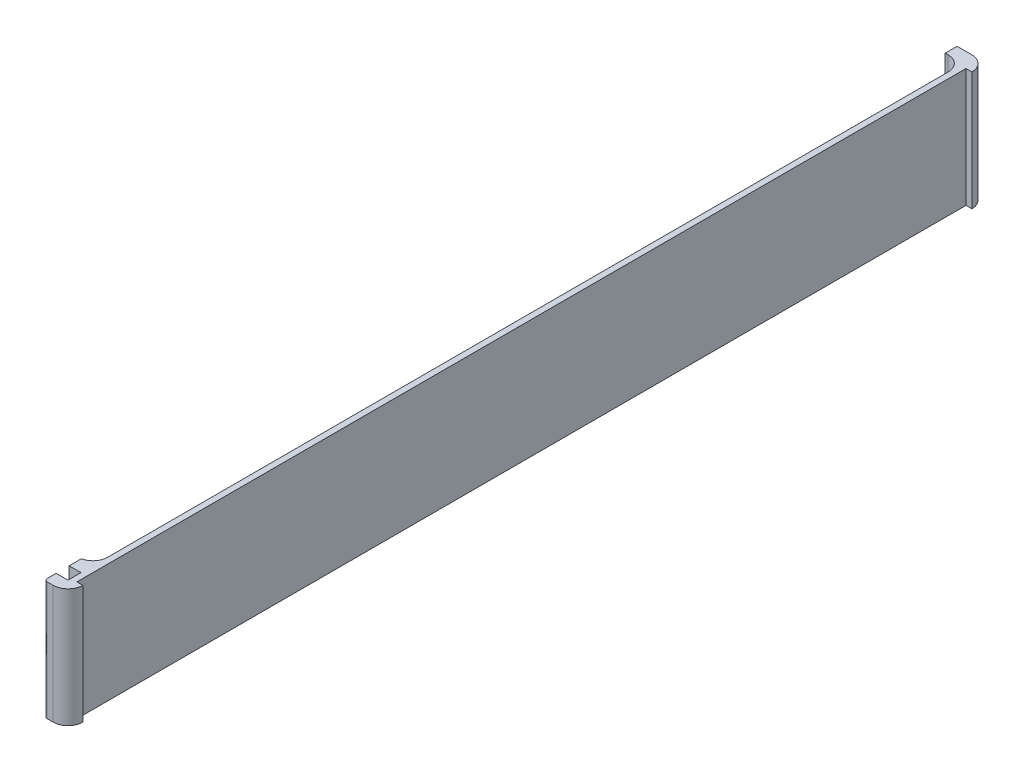
from build123d import *

# Parameters (mm, degrees)
SKETCH1_W                       = 39
SKETCH1_H                       = 155
BOSS_EXTRUDE1_DEPTH             = 2
BOSS_EXTRUDE2_DEPTH             = 38
SKETCH3_W                       = 2
SKETCH3_H                       = 2
BOSS_EXTRUDE3_DEPTH             = 38
SKETCH4_W                       = 2
SKETCH4_H                       = 2
BOSS_EXTRUDE4_DEPTH             = 151
SKETCH6_W                       = 35
SKETCH6_H                       = 2.2
CUT_EXTRUDE1_DEPTH              = 160.340045186
SKETCH7_W                       = 35
SKETCH7_H                       = 2.2
CUT_EXTRUDE2_DEPTH              = 89.490112442
SKETCH5_W                       = 31
SKETCH5_H                       = 2
BOSS_EXTRUDE5_DEPTH             = 2
BOSS_EXTRUDE6_REACH             = 91.367
SKETCH8_W                       = 2
SKETCH8_H                       = 2
BOSS_EXTRUDE6_DIRECTION_2_REACH = 91.367
SKETCH10_W                      = 2
SKETCH10_H                      = 2.2
SKETCH10_W_2                    = 2.2
SKETCH10_H_2                    = 2
BOSS_EXTRUDE8_DEPTH             = 2
SKETCH11_W                      = 2
SKETCH11_H                      = 2.2
SKETCH11_W_2                    = 2.2
SKETCH11_H_2                    = 2
BOSS_EXTRUDE9_DEPTH             = 2
FILLET2_R                       = 2.5
SKETCH14_W                      = 36.5
SKETCH14_H                      = 7.75
BOSS_EXTRUDE10_DEPTH            = 2
SKETCH13_W                      = 31
SKETCH13_H                      = 3
CUT_EXTRUDE4_DEPTH              = 2
FILLET3_R                       = 2
FILLET4_R                       = 0.5
SKETCH15_R                      = 5.1
CUT_EXTRUDE5_DEPTH              = 90.367219941
SKETCH16_R                      = 7.1
BOSS_EXTRUDE11_DEPTH            = 1
FILLET5_R                       = 0.5
CUT_EXTRUDE3_DEPTH              = 160.340045186
FILLET6_R                       = 0.4
FILLET7_R                       = 0.5
CUT_EXTRUDE6_DEPTH              = 6
SKETCH18_W                      = 29
SKETCH18_H                      = 3
CUT_EXTRUDE8_DEPTH              = 90.367220028
CUT_EXTRUDE11_DEPTH             = 90.367220028
CUT_EXTRUDE11_DEPTH_BACK        = 90.367220028
SKETCH20_W                      = 29
SKETCH20_H                      = 34
SKETCH21_W                      = 155
SKETCH21_H                      = 10
CUT_EXTRUDE12_DEPTH             = 90.367219941
SKETCH22_W                      = 150
SKETCH22_H                      = 20
CUT_EXTRUDE13_DEPTH             = 1


with BuildPart() as part:
    # Sketch1 → Boss-Extrude1 (new body)
    with BuildSketch(Plane(origin=(0, 0, 0), x_dir=(1, 0, 0), z_dir=(0, 1, 0))):
        Rectangle(SKETCH1_W, SKETCH1_H)
    extrude(amount=BOSS_EXTRUDE1_DEPTH)

    # Sketch2 → Boss-Extrude2 (add)
    with BuildSketch(Plane(origin=(0, 2, 0), x_dir=(1, 0, 0), z_dir=(0, 1, 0))):
        Polygon((-17.5, -77.5), (-17.5, -75.5), (-17.5, 75.5), (17.5, 75.5), (17.5, -75.5), (17.5, -77.5), (19.5, -77.5), (19.5, 77.5), (-19.5, 77.5), (-19.5, -77.5), align=None)
    extrude(amount=BOSS_EXTRUDE2_DEPTH)

    # Sketch3 → Boss-Extrude3 (add)
    with BuildSketch(Plane(origin=(0, 2, 0), x_dir=(1, 0, 0), z_dir=(0, 1, 0))):
        with Locations((-16.5, -76.5)):
            Rectangle(SKETCH3_W, SKETCH3_H)
        with Locations((-16.5, -72.3)):
            Rectangle(SKETCH3_W, SKETCH3_H)
        with Locations((16.5, -76.5)):
            Rectangle(SKETCH3_W, SKETCH3_H)
        with Locations((16.5, -72.3)):
            Rectangle(SKETCH3_W, SKETCH3_H)
    extrude(amount=BOSS_EXTRUDE3_DEPTH)

    # Sketch4 → Boss-Extrude4 (add)
    with BuildSketch(Plane.XY.offset(-75.5)):
        with Locations((-16.5, 39)):
            Rectangle(SKETCH4_W, SKETCH4_H)
        Polygon((-15.5, 33.8), (-17.5, 31.8), (-17.5, 35.8), (-15.5, 35.8), align=None)
        Polygon((15.5, 35.8), (17.5, 35.8), (17.5, 31.8), (15.5, 33.8), align=None)
        with Locations((16.5, 39)):
            Rectangle(SKETCH4_W, SKETCH4_H)
    extrude(amount=BOSS_EXTRUDE4_DEPTH)

    # Sketch6 → Cut-Extrude1 (cut, through all)
    with BuildSketch(Plane.XY.offset(-75.5)):
        with Locations((0, 36.9)):
            Rectangle(SKETCH6_W, SKETCH6_H)
    extrude(amount=CUT_EXTRUDE1_DEPTH, mode=Mode.SUBTRACT)

    # Sketch7 → Cut-Extrude2 (cut, through all)
    with BuildSketch(Plane(origin=(0, 2, 0), x_dir=(1, 0, 0), z_dir=(0, 1, 0))):
        with Locations((0, -74.4)):
            Rectangle(SKETCH7_W, SKETCH7_H)
    extrude(amount=CUT_EXTRUDE2_DEPTH, mode=Mode.SUBTRACT)

    # Sketch5 → Boss-Extrude5 (add)
    with BuildSketch(Plane(origin=(0, 2, 0), x_dir=(1, 0, 0), z_dir=(0, 1, 0))):
        with Locations((0, -76.5)):
            Rectangle(SKETCH5_W, SKETCH5_H)
        with Locations((0, -72.3)):
            Rectangle(SKETCH5_W, SKETCH5_H)
    extrude(amount=BOSS_EXTRUDE5_DEPTH)

    # Boss-Extrude6: up to this face of the body (flat: up to its plane)
    boss_extrude6_end = Plane(part.part.faces().sort_by_distance((17.5, 16.9, -2.1))[0])
    # Sketch8 → Boss-Extrude6 (add, up to the picked face)
    with BuildSketch(Plane(origin=(0, 0, 0), x_dir=(0, 0, -1), z_dir=(1, 0, 0)), mode=Mode.PRIVATE) as boss_extrude6_sk1:
        with Locations((74.5, 39)):
            Rectangle(SKETCH8_W, SKETCH8_H)
    boss_extrude6_tool1 = split(extrude(boss_extrude6_sk1.sketch, amount=BOSS_EXTRUDE6_REACH, mode=Mode.PRIVATE), bisect_by=boss_extrude6_end, keep=Keep.BOTH, mode=Mode.PRIVATE)
    # Sketch8 → Boss-Extrude6 (add, up to the picked face)
    with BuildSketch(Plane(origin=(0, 0, 0), x_dir=(0, 0, -1), z_dir=(1, 0, 0)), mode=Mode.PRIVATE) as boss_extrude6_sk2:
        Polygon((75.5, 35.8), (73.5, 35.8), (73.5, 33.8), (75.5, 31.8), align=None)
    boss_extrude6_tool2 = split(extrude(boss_extrude6_sk2.sketch, amount=BOSS_EXTRUDE6_REACH, mode=Mode.PRIVATE), bisect_by=boss_extrude6_end, keep=Keep.BOTH, mode=Mode.PRIVATE)
    add(boss_extrude6_tool1.solids().sort_by(Axis((0, 39, -74.5), (1, 0, 0)))[0])
    add(boss_extrude6_tool2.solids().sort_by(Axis((0, 34.244444, -74.611111), (1, 0, 0)))[0])

    # Boss-Extrude6 direction 2: up to this face of the body (flat: up to its plane)
    boss_extrude6_direction_2_end = Plane(part.part.faces().sort_by_distance((-17.5, 16.9, -2.1))[0])
    # Sketch8 → Boss-Extrude6 direction 2 (add, up to the picked face)
    with BuildSketch(Plane(origin=(0, 0, 0), x_dir=(0, 0, -1), z_dir=(1, 0, 0)), mode=Mode.PRIVATE) as boss_extrude6_direction_2_sk1:
        with Locations((74.5, 39)):
            Rectangle(SKETCH8_W, SKETCH8_H)
    boss_extrude6_direction_2_tool1 = split(extrude(boss_extrude6_direction_2_sk1.sketch, amount=-BOSS_EXTRUDE6_DIRECTION_2_REACH, mode=Mode.PRIVATE), bisect_by=boss_extrude6_direction_2_end, keep=Keep.BOTH, mode=Mode.PRIVATE)
    # Sketch8 → Boss-Extrude6 direction 2 (add, up to the picked face)
    with BuildSketch(Plane(origin=(0, 0, 0), x_dir=(0, 0, -1), z_dir=(1, 0, 0)), mode=Mode.PRIVATE) as boss_extrude6_direction_2_sk2:
        Polygon((75.5, 35.8), (73.5, 35.8), (73.5, 33.8), (75.5, 31.8), align=None)
    boss_extrude6_direction_2_tool2 = split(extrude(boss_extrude6_direction_2_sk2.sketch, amount=-BOSS_EXTRUDE6_DIRECTION_2_REACH, mode=Mode.PRIVATE), bisect_by=boss_extrude6_direction_2_end, keep=Keep.BOTH, mode=Mode.PRIVATE)
    add(boss_extrude6_direction_2_tool1.solids().sort_by(Axis((0, 39, -74.5), (-1, 0, 0)))[0])
    add(boss_extrude6_direction_2_tool2.solids().sort_by(Axis((0, 34.244444, -74.611111), (-1, 0, 0)))[0])

    # Sketch10 → Boss-Extrude8 (add)
    with BuildSketch(Plane(origin=(-17.5, 0, 0), x_dir=(0, 0, -1), z_dir=(1, 0, 0))):
        with Locations((-76.5, 36.9)):
            Rectangle(SKETCH10_W, SKETCH10_H)
        with Locations((-74.4, 39)):
            Rectangle(SKETCH10_W_2, SKETCH10_H_2)
    extrude(amount=BOSS_EXTRUDE8_DEPTH)

    # Sketch11 → Boss-Extrude9 (add)
    with BuildSketch(Plane.ZY.offset(-17.5)):
        with Locations((76.5, 36.9)):
            Rectangle(SKETCH11_W, SKETCH11_H)
        with Locations((74.4, 39)):
            Rectangle(SKETCH11_W_2, SKETCH11_H_2)
    extrude(amount=BOSS_EXTRUDE9_DEPTH)

    # Fillet2
    fillet2_edges = [part.edges().sort_by_distance(p)[0] for p in [
        (-17.5, 16.9, 71.3),
        (17.5, 16.9, 71.3),
        (19.5, 20, 77.5),
        (-19.5, 20, 77.5),
        (-19.5, 20, -77.5),
        (-17.5, 16.9, -75.5),
        (17.5, 16.9, -75.5),
        (19.5, 20, -77.5),
        (19.5, 40, 0),
        (-19.5, 40, 0),
        (19.5, 0, 0),
        (-19.5, 0, 0),
        (0, 40, -77.5),
        (0, 0, 77.5),
        (0, 0, -77.5),
        (-17.5, 40, 77.5),
        (17.5, 40, 77.5),
    ]]
    fillet(fillet2_edges, radius=FILLET2_R)

    # Sketch14 → Boss-Extrude10 (add)
    with BuildSketch(Plane.XY.offset(-75.5)):
        with Locations((0, 5.125)):
            Rectangle(SKETCH14_W, SKETCH14_H)
    extrude(amount=BOSS_EXTRUDE10_DEPTH)

    # Sketch13 → Cut-Extrude4 (cut)
    with BuildSketch(Plane(origin=(0, 0, -77.5), x_dir=(-1, 0, 0), z_dir=(0, 0, -1))):
        with Locations((0, 5.5)):
            Rectangle(SKETCH13_W, SKETCH13_H)
    extrude(amount=-CUT_EXTRUDE4_DEPTH, mode=Mode.SUBTRACT)

    # Fillet3
    fillet3_edges = [part.edges().sort_by_distance(p)[0] for p in [
        (0, 9, -73.5),
    ]]
    fillet(fillet3_edges, radius=FILLET3_R - 0.0001)  # a hair under: the kernel refuses the full size

    # Fillet4
    fillet4_edges = [part.edges().sort_by_distance(p)[0] for p in [
        (15.5, 5.5, -75.5),
        (15.5, 4, -76.5),
        (0, 7, -75.5),
        (15.5, 7, -76.5),
        (-15.5, 5.5, -75.5),
        (-15.5, 7, -76.5),
        (0, 4, -75.5),
        (-15.5, 4, -76.5),
        (15.5, 5.5, -77.5),
        (0, 4, -77.5),
        (-15.5, 5.5, -77.5),
        (0, 7, -77.5),
    ]]
    fillet(fillet4_edges, radius=FILLET4_R)

    # Sketch15 → Cut-Extrude5 (cut, through all)
    with BuildSketch(Plane.XZ):
        with Locations(Location((0, 38.75, 0), (0, 0, 270))):
            Circle(SKETCH15_R)
        with Locations(Location((0, -38.75, 0), (0, 0, 270))):
            Circle(SKETCH15_R)
    extrude(amount=-CUT_EXTRUDE5_DEPTH, mode=Mode.SUBTRACT)

    # Sketch16 → Boss-Extrude11 (add)
    with BuildSketch(Plane(origin=(0, 2, 0), x_dir=(1, 0, 0), z_dir=(0, 1, 0))):
        with Locations(Location((0, 38.75, 0), (0, 0, 270))):
            Circle(SKETCH16_R)
        with Locations(Location((0, -38.75, 0), (0, 0, 270))):
            Circle(SKETCH16_R)
    extrude(amount=BOSS_EXTRUDE11_DEPTH)

    # Fillet5
    fillet5_edges = [part.edges().sort_by_distance(p)[0] for p in [
        (0, 2, -45.85),
        (0, 3, -45.85),
        (0, 2, 31.65),
        (0, 3, 31.65),
    ]]
    fillet(fillet5_edges, radius=FILLET5_R - 0.0001)  # a hair under: the kernel refuses the full size

    # Sketch12 → Cut-Extrude3 (cut, through all)
    with BuildSketch(Plane.XY.offset(-75.5)):
        with BuildLine():
            Line((1.668907005, 12.688040659), (2.22520934, 10.250720878))
            ThreePointArc((2.22520934, 10.250720878), (4.338837391, 10.990311321), (6.234898019, 12.181685175))
            Line((6.234898019, 12.181685175), (4.676173514, 14.136263881))
            ThreePointArc((4.676173514, 14.136263881), (3.254128043, 13.242733491), (1.668907005, 12.688040659))
        make_face()
        with BuildLine():
            ThreePointArc((-6.234898019, 12.181685175), (-4.338837391, 10.990311321), (-2.22520934, 10.250720878))
            Line((-2.22520934, 10.250720878), (-1.668907005, 12.688040659))
            ThreePointArc((-1.668907005, 12.688040659), (-3.254128043, 13.242733491), (-4.676173514, 14.136263881))
            Line((-4.676173514, 14.136263881), (-6.234898019, 12.181685175))
        make_face()
        with BuildLine():
            ThreePointArc((-10, 20), (-9.749279122, 17.77479066), (-9.009688679, 15.661162609))
            Line((-9.009688679, 15.661162609), (-6.757266509, 16.745871957))
            ThreePointArc((-6.757266509, 16.745871957), (-7.311959341, 18.331092995), (-7.5, 20))
            Line((-7.5, 20), (-10, 20))
        make_face()
        with BuildLine():
            ThreePointArc((-6.234898019, 27.818314825), (-7.818314825, 26.234898019), (-9.009688679, 24.338837391))
            Line((-9.009688679, 24.338837391), (-6.757266509, 23.254128043))
            ThreePointArc((-6.757266509, 23.254128043), (-5.863736119, 24.676173514), (-4.676173514, 25.863736119))
            Line((-4.676173514, 25.863736119), (-6.234898019, 27.818314825))
        make_face()
        with BuildLine():
            ThreePointArc((-1.668907005, 27.311959341), (-0.839733571, 27.452841574), (0, 27.5))
            Line((0, 27.5), (0, 30))
            ThreePointArc((0, 30), (-1.119644761, 29.937122099), (-2.22520934, 29.749279122))
            Line((-2.22520934, 29.749279122), (-1.668907005, 27.311959341))
        make_face()
        with BuildLine():
            Line((0, 30), (0, 27.5))
            ThreePointArc((0, 27.5), (0.839733571, 27.452841574), (1.668907005, 27.311959341))
            Line((1.668907005, 27.311959341), (2.22520934, 29.749279122))
            ThreePointArc((2.22520934, 29.749279122), (1.119644761, 29.937122099), (0, 30))
        make_face()
        with BuildLine():
            Line((6.757266509, 23.254128043), (9.009688679, 24.338837391))
            ThreePointArc((9.009688679, 24.338837391), (7.818314825, 26.234898019), (6.234898019, 27.818314825))
            Line((6.234898019, 27.818314825), (4.676173514, 25.863736119))
            ThreePointArc((4.676173514, 25.863736119), (5.863736119, 24.676173514), (6.757266509, 23.254128043))
        make_face()
        with BuildLine():
            Line((6.757266509, 16.745871957), (9.009688679, 15.661162609))
            ThreePointArc((9.009688679, 15.661162609), (9.749279122, 17.77479066), (10, 20))
            Line((10, 20), (7.5, 20))
            ThreePointArc((7.5, 20), (7.311959341, 18.331092995), (6.757266509, 16.745871957))
        make_face()
        with BuildLine():
            ThreePointArc((2.5, 20), (2.43731978, 19.443697665), (2.25242217, 18.915290652))
            Line((2.25242217, 18.915290652), (4.50484434, 17.830581304))
            ThreePointArc((4.50484434, 17.830581304), (4.874639561, 18.88739533), (5, 20))
            Line((5, 20), (2.5, 20))
        make_face()
        with BuildLine():
            ThreePointArc((1.558724505, 21.954578706), (1.954578706, 21.558724505), (2.25242217, 21.084709348))
            Line((2.25242217, 21.084709348), (4.50484434, 22.169418696))
            ThreePointArc((4.50484434, 22.169418696), (3.909157412, 23.117449009), (3.117449009, 23.909157412))
            Line((3.117449009, 23.909157412), (1.558724505, 21.954578706))
        make_face()
        with BuildLine():
            Line((0, 25), (0, 22.5))
            ThreePointArc((0, 22.5), (0.27991119, 22.484280525), (0.556302335, 22.43731978))
            Line((0.556302335, 22.43731978), (1.11260467, 24.874639561))
            ThreePointArc((1.11260467, 24.874639561), (0.559822381, 24.968561049), (0, 25))
        make_face()
        with BuildLine():
            ThreePointArc((-0.556302335, 22.43731978), (-0.27991119, 22.484280525), (0, 22.5))
            Line((0, 22.5), (0, 25))
            ThreePointArc((0, 25), (-0.559822381, 24.968561049), (-1.11260467, 24.874639561))
            Line((-1.11260467, 24.874639561), (-0.556302335, 22.43731978))
        make_face()
        with BuildLine():
            ThreePointArc((-2.25242217, 21.084709348), (-1.954578706, 21.558724505), (-1.558724505, 21.954578706))
            Line((-1.558724505, 21.954578706), (-3.117449009, 23.909157412))
            ThreePointArc((-3.117449009, 23.909157412), (-3.909157412, 23.117449009), (-4.50484434, 22.169418696))
            Line((-4.50484434, 22.169418696), (-2.25242217, 21.084709348))
        make_face()
        with BuildLine():
            ThreePointArc((-2.25242217, 18.915290652), (-2.43731978, 19.443697665), (-2.5, 20))
            Line((-2.5, 20), (-5, 20))
            ThreePointArc((-5, 20), (-4.874639561, 18.88739533), (-4.50484434, 17.830581304))
            Line((-4.50484434, 17.830581304), (-2.25242217, 18.915290652))
        make_face()
        with BuildLine():
            ThreePointArc((-3.117449009, 16.090842588), (-2.169418696, 15.49515566), (-1.11260467, 15.125360439))
            Line((-1.11260467, 15.125360439), (-0.556302335, 17.56268022))
            ThreePointArc((-0.556302335, 17.56268022), (-1.084709348, 17.74757783), (-1.558724505, 18.045421294))
            Line((-1.558724505, 18.045421294), (-3.117449009, 16.090842588))
        make_face()
        with BuildLine():
            Line((0.556302335, 17.56268022), (1.11260467, 15.125360439))
            ThreePointArc((1.11260467, 15.125360439), (2.169418696, 15.49515566), (3.117449009, 16.090842588))
            Line((3.117449009, 16.090842588), (1.558724505, 18.045421294))
            ThreePointArc((1.558724505, 18.045421294), (1.084709348, 17.74757783), (0.556302335, 17.56268022))
        make_face()
    extrude(amount=-CUT_EXTRUDE3_DEPTH, mode=Mode.SUBTRACT)

    # Fillet6
    fillet6_edges = [part.edges().sort_by_distance(p)[0] for p in [
        (5.863736119, 24.676173514, -75.5),
        (5.455535766, 26.841025472, -75.5),
        (7.818314825, 26.234898019, -77.5),
        (7.883477594, 23.796482717, -77.5),
        (5.863736119, 24.676173514, -77.5),
        (5.455535766, 26.841025472, -77.5),
        (7.883477594, 23.796482717, -75.5),
        (7.818314825, 26.234898019, -75.5),
        (7.311959341, 18.331092995, -75.5),
        (8.75, 20, -75.5),
        (9.749279122, 17.77479066, -77.5),
        (7.883477594, 16.203517283, -77.5),
        (7.311959341, 18.331092995, -77.5),
        (8.75, 20, -77.5),
        (7.883477594, 16.203517283, -75.5),
        (9.749279122, 17.77479066, -75.5),
        (2.43731978, 19.443697665, -75.5),
        (3.75, 20, -75.5),
        (4.874639561, 18.88739533, -77.5),
        (3.378633255, 18.372935978, -77.5),
        (2.43731978, 19.443697665, -77.5),
        (3.75, 20, -77.5),
        (3.378633255, 18.372935978, -75.5),
        (4.874639561, 18.88739533, -75.5),
        (1.954578706, 21.558724505, -75.5),
        (2.338086757, 22.931868059, -75.5),
        (3.909157412, 23.117449009, -77.5),
        (3.378633255, 21.627064022, -77.5),
        (1.954578706, 21.558724505, -77.5),
        (2.338086757, 22.931868059, -77.5),
        (3.378633255, 21.627064022, -75.5),
        (3.909157412, 23.117449009, -75.5),
        (0, 27.5, -75.5),
        (-1.947058172, 28.530619232, -75.5),
        (0, 30, -77.5),
        (1.947058172, 28.530619232, -77.5),
        (0, 27.5, -77.5),
        (-1.947058172, 28.530619232, -77.5),
        (1.947058172, 28.530619232, -75.5),
        (0, 30, -75.5),
        (-5.863736119, 24.676173514, -75.5),
        (-7.883477594, 23.796482717, -75.5),
        (-7.818314825, 26.234898019, -77.5),
        (-5.455535766, 26.841025472, -77.5),
        (-5.863736119, 24.676173514, -77.5),
        (-7.883477594, 23.796482717, -77.5),
        (-5.455535766, 26.841025472, -75.5),
        (-7.818314825, 26.234898019, -75.5),
        (-7.311959341, 18.331092995, -75.5),
        (-7.883477594, 16.203517283, -75.5),
        (-9.749279122, 17.77479066, -77.5),
        (-8.75, 20, -77.5),
        (-7.311959341, 18.331092995, -77.5),
        (-7.883477594, 16.203517283, -77.5),
        (-8.75, 20, -75.5),
        (-9.749279122, 17.77479066, -75.5),
        (-3.254128043, 13.242733491, -75.5),
        (-1.947058172, 11.469380768, -75.5),
        (-4.338837391, 10.990311321, -77.5),
        (-5.455535766, 13.158974528, -77.5),
        (-3.254128043, 13.242733491, -77.5),
        (-1.947058172, 11.469380768, -77.5),
        (-5.455535766, 13.158974528, -75.5),
        (-4.338837391, 10.990311321, -75.5),
        (1.084709348, 17.74757783, -75.5),
        (2.338086757, 17.068131941, -75.5),
        (2.169418696, 15.49515566, -77.5),
        (0.834453502, 16.344020329, -77.5),
        (1.084709348, 17.74757783, -77.5),
        (2.338086757, 17.068131941, -77.5),
        (0.834453502, 16.344020329, -75.5),
        (2.169418696, 15.49515566, -75.5),
        (-2.43731978, 19.443697665, -75.5),
        (-3.378633255, 18.372935978, -75.5),
        (-4.874639561, 18.88739533, -77.5),
        (-3.75, 20, -77.5),
        (-2.43731978, 19.443697665, -77.5),
        (-3.378633255, 18.372935978, -77.5),
        (-3.75, 20, -75.5),
        (-4.874639561, 18.88739533, -75.5),
        (-1.084709348, 17.74757783, -75.5),
        (-0.834453502, 16.344020329, -75.5),
        (-2.169418696, 15.49515566, -77.5),
        (-2.338086757, 17.068131941, -77.5),
        (-1.084709348, 17.74757783, -77.5),
        (-0.834453502, 16.344020329, -77.5),
        (-2.338086757, 17.068131941, -75.5),
        (-2.169418696, 15.49515566, -75.5),
        (-1.954578706, 21.558724505, -75.5),
        (-3.378633255, 21.627064022, -75.5),
        (-3.909157412, 23.117449009, -77.5),
        (-2.338086757, 22.931868059, -77.5),
        (-1.954578706, 21.558724505, -77.5),
        (-3.378633255, 21.627064022, -77.5),
        (-2.338086757, 22.931868059, -75.5),
        (-3.909157412, 23.117449009, -75.5),
        (0, 25, -77.5),
        (0.834453502, 23.655979671, -77.5),
        (0, 22.5, -75.5),
        (-0.834453502, 23.655979671, -75.5),
        (0, 22.5, -77.5),
        (-0.834453502, 23.655979671, -77.5),
        (0, 25, -75.5),
        (0.834453502, 23.655979671, -75.5),
        (3.254128043, 13.242733491, -75.5),
        (5.455535766, 13.158974528, -75.5),
        (4.338837391, 10.990311321, -77.5),
        (1.947058172, 11.469380768, -77.5),
        (3.254128043, 13.242733491, -77.5),
        (5.455535766, 13.158974528, -77.5),
        (1.947058172, 11.469380768, -75.5),
        (4.338837391, 10.990311321, -75.5),
    ]]
    fillet(fillet6_edges, radius=FILLET6_R)

    # Fillet7
    fillet7_edges = [part.edges().sort_by_distance(p)[0] for p in [
        (15.5, 40, 0.75),
        (0, 4, 77.5),
        (0, 40, -73.5),
        (-15.5, 40, 0.75),
        (-15.5, 20.75, 77.5),
        (-15.5, 39.267766953, 76.767766953),
        (15.5, 20.75, 77.5),
        (15.5, 39.267766953, 76.767766953),
    ]]
    fillet(fillet7_edges, radius=FILLET7_R)

    # Sketch17 → Cut-Extrude6 (cut)
    with BuildSketch(Plane.XZ):
        Polygon((-17, -77.5), (-17, 70.299999999), (-14.999999999, 71.3), (-14.999999999, 77.5), (14.999999999, 77.5), (14.999999999, 71.3), (17, 70.299999999), (17, -77.5), align=None)
    extrude(amount=-CUT_EXTRUDE6_DEPTH, mode=Mode.SUBTRACT)

    # Sketch18 → Cut-Extrude8 (cut, through all)
    with BuildSketch(Plane.XY):
        with Locations((0, 7.5)):
            Rectangle(SKETCH18_W, SKETCH18_H)
    extrude(amount=-CUT_EXTRUDE8_DEPTH, mode=Mode.SUBTRACT)

    # Sketch20 → Cut-Extrude11 (cut, two sides: drawn at the far end of the back side and taken through both)
    with BuildSketch(Plane.XY.offset(-CUT_EXTRUDE11_DEPTH_BACK)):
        with Locations((0, 23)):
            Rectangle(SKETCH20_W, SKETCH20_H)
    extrude(amount=CUT_EXTRUDE11_DEPTH + CUT_EXTRUDE11_DEPTH_BACK, mode=Mode.SUBTRACT)


with BuildPart() as body_2:
    # of the pieces the cut leaves, the one that is kept (cut_extrude11_keep)
    add(part.part.solids().sort_by_distance((14.5, 40, -75))[0])

    # Sketch21 → Cut-Extrude12 (cut, through all)
    with BuildSketch(Plane(origin=(0, 0, 0), x_dir=(0, 0, -1), z_dir=(1, 0, 0))):
        with Locations((0, 35)):
            Rectangle(SKETCH21_W, SKETCH21_H)
        with Locations((0, 5)):
            Rectangle(SKETCH21_W, SKETCH21_H)
    extrude(amount=CUT_EXTRUDE12_DEPTH, mode=Mode.SUBTRACT)

    # Sketch22 → Cut-Extrude13 (cut)
    with BuildSketch(Plane(origin=(19.5, 0, 0), x_dir=(0, 0, -1), z_dir=(1, 0, 0))):
        with Locations((0, 20)):
            Rectangle(SKETCH22_W, SKETCH22_H)
    extrude(amount=-CUT_EXTRUDE13_DEPTH, mode=Mode.SUBTRACT)


solid = body_2.part
